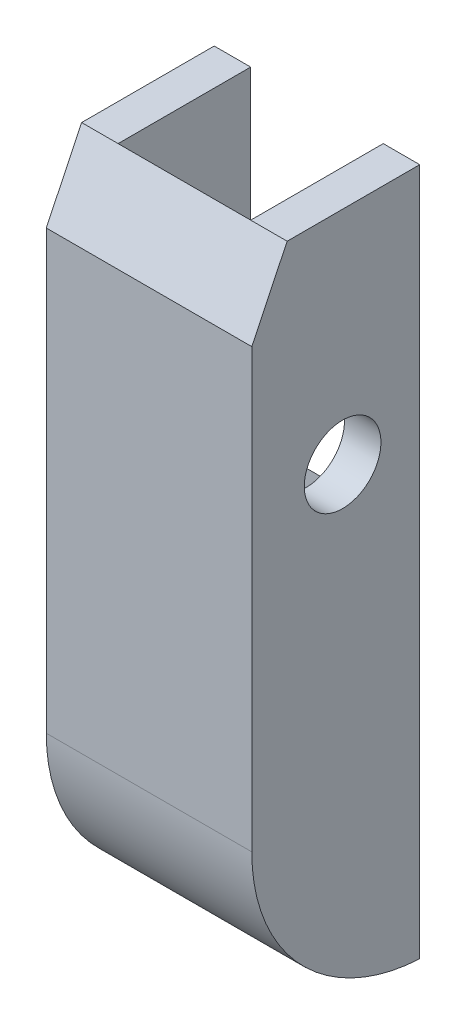
from build123d import *

# Parameters (mm, degrees)
SKETCH1_W               = 11.811
SKETCH1_H               = 45.98924
BOSS_EXTRUDE1_DEPTH     = 9.652
FILLET5_R               = 4.826
SKETCH2_W               = 7.62
SKETCH2_H               = 22.352
CUT_EXTRUDE1_DEPTH      = 7.62
CUT_EXTRUDE2_DEPTH      = 49.452771033
CUT_EXTRUDE2_DEPTH_BACK = 49.452771033
SKETCH3_R               = 2.20345
FILLET4_R               = 4.826
FILLET6_R               = 10.16
CUT_EXTRUDE3_DEPTH      = 49.452771033
CUT_EXTRUDE4_DEPTH      = 7.62
BOSS_EXTRUDE2_DEPTH     = 7.62


with BuildPart() as part:
    # Sketch1 → Boss-Extrude1 (new body)
    with BuildSketch(Plane.XY):
        with Locations((5.9055, 22.99462)):
            Rectangle(SKETCH1_W, SKETCH1_H)
    extrude(amount=BOSS_EXTRUDE1_DEPTH)

    # Fillet5
    fillet5_edges = [part.edges().sort_by_distance(p)[0] for p in [
        (5.9055, 45.98924, 0),
    ]]
    fillet(fillet5_edges, radius=FILLET5_R)

    # Sketch2 → Cut-Extrude1 (cut)
    with BuildSketch(Plane(origin=(0, 0, 0), x_dir=(-1, 0, 0), z_dir=(0, 0, -1))):
        with Locations((-5.9055, 34.81324)):
            Rectangle(SKETCH2_W, SKETCH2_H)
    extrude(amount=-CUT_EXTRUDE1_DEPTH, mode=Mode.SUBTRACT)

    # Sketch3 → Cut-Extrude2 (cut, two sides: drawn at the far end of the back side and taken through both)
    with BuildSketch(Plane.ZY.offset(-CUT_EXTRUDE2_DEPTH_BACK)):
        with Locations((4.4323, 26.82494)):
            Circle(SKETCH3_R)
    extrude(amount=CUT_EXTRUDE2_DEPTH + CUT_EXTRUDE2_DEPTH_BACK, mode=Mode.SUBTRACT)

    # Fillet4
    # the kernel refuses this fillet: 4.826 mm, written as the material it takes off along each edge
    with BuildSketch(Plane(origin=(23.876, 45.98924, 9.652), x_dir=(0, 0, -1), z_dir=(-1, 0, 0))) as fillet4_piece_1:
        with BuildLine():
            CenterArc((FILLET4_R, FILLET4_R), FILLET4_R, 180, 90)
            Line((0, FILLET4_R), (0, 0))
            Line((0, 0), (FILLET4_R, 0))
        make_face()
    extrude(amount=35.941, mode=Mode.SUBTRACT)

    # Fillet6
    # the kernel refuses this fillet: 10.16 mm, written as the material it takes off along each edge
    with BuildSketch(Plane(origin=(-25.368230131, 0, 9.652), x_dir=(0, 1, 0), z_dir=(1, 0, 0))) as fillet6_piece_1:
        with BuildLine():
            CenterArc((10.147292053, -10.16), FILLET6_R, 90, 87.134016017)
            Line((0, -9.652), (-0.202945841, -9.64184))
            ThreePointArc((-0.202945841, -9.64184), (-0.2032, -4.826), (-0.2032, 0))
            Line((-0.2032, 0), (0, 0.2032))
            Line((0, 0.2032), (10.147292053, 0.2032))
            Line((10.147292053, 0.2032), (10.147292053, 0))
        make_face()
    extrude(amount=62.547460263, mode=Mode.SUBTRACT)

    # Sketch4 → Cut-Extrude3 (cut, through all)
    with BuildSketch(Plane(origin=(11.811, 0, 0), x_dir=(0, 0, -1), z_dir=(1, 0, 0))):
        Polygon((-9.652, 35.293813088), (-7.62, 39.52494), (0, 39.52494), (0, 45.98924), (-9.652, 45.98924), align=None)
    extrude(amount=-CUT_EXTRUDE3_DEPTH, mode=Mode.SUBTRACT)

    # Sketch5 → Cut-Extrude4 (cut)
    with BuildSketch(Plane.ZY.offset(-9.7155)):
        Polygon((0, 21.160076085), (5.158068358, 23.63724), (0, 23.63724), align=None)
    extrude(amount=CUT_EXTRUDE4_DEPTH, mode=Mode.SUBTRACT)

    # Sketch5<3> → Boss-Extrude2 (add)
    with BuildSketch(Plane.ZY.offset(-9.7155)):
        with BuildLine():
            Line((5.812301369, 23.951435604), (5.158068358, 23.63724))
            Line((5.158068358, 23.63724), (7.62, 23.63724))
            Line((7.62, 23.63724), (7.62, 26.82494))
            ThreePointArc((7.62, 26.82494), (7.130490287, 25.127530072), (5.812301369, 23.951435604))
        make_face()
    extrude(amount=BOSS_EXTRUDE2_DEPTH)


solid = part.part
